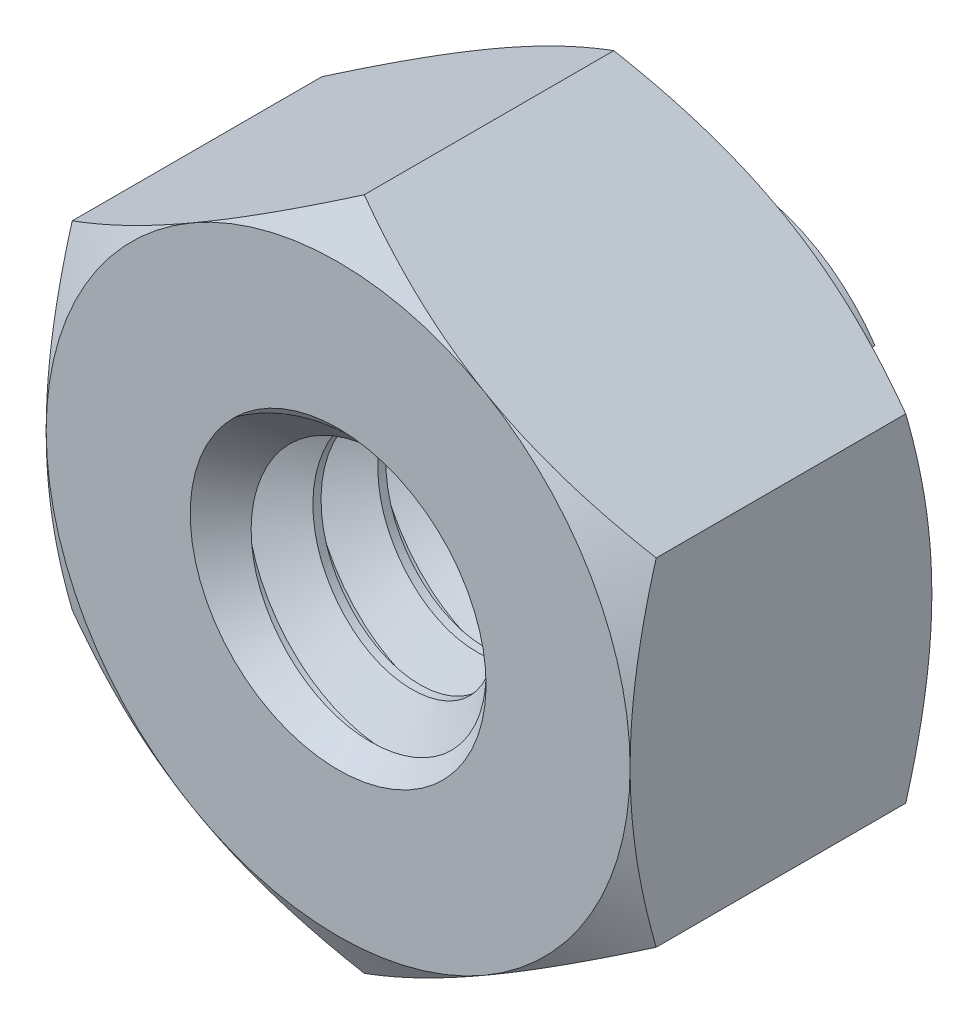
from build123d import *

# Parameters (mm, degrees)
EXTRUDE1_DEPTH          = 6.35
SKETCH2_OUTSIDE_W       = 51.616
SKETCH2_OUTSIDE_H       = 53.088
SKETCH2_OUTSIDE_R       = 4.7625
CUT_EXTRUDE1_DEPTH      = 10.656385517
CUT_EXTRUDE1_DRAFT      = -60
SKETCH4_R               = 2.413
CUT_EXTRUDE3_DEPTH      = 10.656385517
SWEEP1_PITCH            = 1.058333333
CUT_EXTRUDE8_DEPTH      = 11.383123514
CUT_EXTRUDE9_DEPTH      = 10.656385689
SKETCH12_OUTSIDE_W      = 14.702
SKETCH12_OUTSIDE_H      = 16.174
SKETCH12_OUTSIDE_R      = 2.8956
CUT_EXTRUDE10_DEPTH     = 1.42875
SKETCH15_W              = 0.381
SKETCH15_H              = 5.499261314
CUT_EXTRUDE_THIN2_DEPTH = 0.92075
CIRPATTERN1_COUNT       = 6
SKETCH3_OUTSIDE_W       = 48.59
SKETCH3_OUTSIDE_H       = 50.062
SKETCH3_OUTSIDE_R       = 4.7625
CUT_EXTRUDE2_DEPTH      = 9.783050993
CUT_EXTRUDE2_DRAFT      = -60


with BuildPart() as part:
    # Sketch1 → Extrude1 (new body)
    with BuildSketch(Plane.XY):
        Polygon((0, 5.499261314), (-4.7625, 2.749630657), (-4.7625, -2.749630657), (0, -5.499261314), (4.7625, -2.749630657), (4.7625, 2.749630657), align=None)
    extrude(amount=-EXTRUDE1_DEPTH)


with BuildPart() as cut_extrude1_tool:
    # Sketch2 outside → Cut-Extrude1 (with draft: the straight prism first)
    with BuildSketch(Plane.XY):
        Rectangle(SKETCH2_OUTSIDE_W, SKETCH2_OUTSIDE_H)
        Circle(SKETCH2_OUTSIDE_R, mode=Mode.SUBTRACT)
    extrude(amount=-CUT_EXTRUDE1_DEPTH)
    # Cut-Extrude1: the draft: its side faces are tilted about the plane it starts from
    cut_extrude1_sides = [cut_extrude1_tool.faces().sort_by_distance(p)[0] for p in [
        (0, -26.544, -5.328192758),
        (25.808, 0, -5.328192758),
        (0, 26.544, -5.328192758),
        (-25.808, 0, -5.328192758),
        (-4.7625, 0, -5.328192758),
    ]]
    draft(cut_extrude1_sides, Plane.XY, CUT_EXTRUDE1_DRAFT)


with BuildPart() as part_1:
    add(part.part)

    # Cut-Extrude1: cut by cut_extrude1_tool
    add(cut_extrude1_tool.part, mode=Mode.SUBTRACT)

    # Sketch4 → Cut-Extrude3 (cut, through all)
    with BuildSketch(Plane.XY):
        Circle(SKETCH4_R)
    extrude(amount=-CUT_EXTRUDE3_DEPTH, mode=Mode.SUBTRACT)

    # Sweep1: the profile of Sketch9 profile screwed along a right-hand helix of 7 turns, 6 arcs to a turn; built about Z, then put on its axis
    sweep1_z = Axis((0, 0, 0), (0, 0, 1))
    sweep1_corners = [(1.725592336, 0, -0.529166667), (1.725592336, 0, -0.396875), (2.4133, 0, 0.000173205), (2.4133, 0, -0.926214872)]
    with BuildLine(mode=Mode.PRIVATE) as sweep1_profile:
        Line(sweep1_corners[0], sweep1_corners[1])
        Line(sweep1_corners[1], sweep1_corners[2])
        Line(sweep1_corners[2], sweep1_corners[3])
        Line(sweep1_corners[3], sweep1_corners[0])
    sweep1_cap = Face(sweep1_profile.wire())
    sweep1_turn_angles = [0, 30, 60, 90, 120, 150, 180, 210, 240, 270, 300, 330, 360]
    sweep1_turn_weights = [1, 0.8660254037844387, 1, 0.8660254037844387, 1, 0.8660254037844387, 1, 0.8660254037844387, 1, 0.8660254037844387, 1, 0.8660254037844387, 1]
    sweep1_turn_rails = [Edge.make_bspline([Vector(p[0], p[1], 0).rotate(sweep1_z, sweep1_turn_angles[k]) / sweep1_turn_weights[k] + Vector(0, 0, p[2] + SWEEP1_PITCH * sweep1_turn_angles[k] / 360) for k in range(13)], [0, 0, 0, 1, 1, 2, 2, 3, 3, 4, 4, 5, 5, 6, 6, 6], 2, sweep1_turn_weights) for p in sweep1_corners]
    sweep1_turn_sides = [Face.make_surface_from_curves(sweep1_turn_rails[p[0]], sweep1_turn_rails[p[1]]) for p in [(0, 1), (1, 2), (2, 3), (3, 0)]]
    sweep1 = Plane(origin=(0, 0, 0), x_dir=(0, 1, 0), z_dir=(0, 0, -1)) * Solid(Shell([*[p.moved(Location((0, 0, SWEEP1_PITCH * i))) for i in range(7) for p in sweep1_turn_sides], sweep1_cap, sweep1_cap.rotate(sweep1_z, 2520).moved(Location((0, 0, SWEEP1_PITCH * 2520 / 360)))]))
    add(sweep1)

    # Sketch10 → Cut-Extrude8 (cut, through all)
    with BuildSketch(Plane.XY):
        Polygon((0, 5.499261314), (-4.7625, 2.749630657), (-4.7625, -2.749630657), (0, -5.499261314), (4.7625, -2.749630657), (4.7625, 2.749630657), align=None)
    extrude(amount=CUT_EXTRUDE8_DEPTH, mode=Mode.SUBTRACT)

    # Sketch11 → Cut-Extrude9 (cut, through all)
    with BuildSketch(Plane(origin=(0, 0, -6.35), x_dir=(-1, 0, 0), z_dir=(0, 0, -1))):
        Polygon((4.7625, 2.749630657), (0, 5.499261314), (-4.7625, 2.749630657), (-4.7625, -2.749630657), (0, -5.499261314), (4.7625, -2.749630657), align=None)
    extrude(amount=CUT_EXTRUDE9_DEPTH, mode=Mode.SUBTRACT)

    # Sketch12 outside → Cut-Extrude10 (cut)
    with BuildSketch(Plane(origin=(0, 0, -6.35), x_dir=(-1, 0, 0), z_dir=(0, 0, -1))):
        Rectangle(SKETCH12_OUTSIDE_W, SKETCH12_OUTSIDE_H)
        Circle(SKETCH12_OUTSIDE_R, mode=Mode.SUBTRACT)
    extrude(amount=-CUT_EXTRUDE10_DEPTH, mode=Mode.SUBTRACT)

    # Sketch15 → Cut-Extrude-Thin2 (cut)
    with BuildSketch(Plane(origin=(0, 0, -6.35), x_dir=(-1, 0, 0), z_dir=(0, 0, -1))):
        with Locations((0, -2.749630657)):
            Rectangle(SKETCH15_W, SKETCH15_H)
    cut_extrude_thin2 = extrude(amount=-CUT_EXTRUDE_THIN2_DEPTH, mode=Mode.SUBTRACT)

    # CirPattern1: Cut-Extrude-Thin2 ×6 about axis
    cirpattern1_axis = Axis((0, 0, 0), (0, 0, 1))
    for i in range(1, CIRPATTERN1_COUNT):
        add(cut_extrude_thin2.rotate(cirpattern1_axis, i * 360 / CIRPATTERN1_COUNT), mode=Mode.SUBTRACT)


with BuildPart() as cut_extrude2_tool:
    # Sketch3 outside → Cut-Extrude2 (with draft: the straight prism first)
    with BuildSketch(Plane(origin=(0, 0, -4.92125), x_dir=(-1, 0, 0), z_dir=(0, 0, -1))):
        Rectangle(SKETCH3_OUTSIDE_W, SKETCH3_OUTSIDE_H)
        Circle(SKETCH3_OUTSIDE_R, mode=Mode.SUBTRACT)
    extrude(amount=-CUT_EXTRUDE2_DEPTH)
    # Cut-Extrude2: the draft: its side faces are tilted about the plane it starts from
    cut_extrude2_sides = [cut_extrude2_tool.faces().sort_by_distance(p)[0] for p in [
        (0, -25.031, -0.029724503),
        (-24.295, 0, -0.029724503),
        (0, 25.031, -0.029724503),
        (24.295, 0, -0.029724503),
        (4.7625, 0, -0.029724503),
    ]]
    draft(cut_extrude2_sides, Plane(origin=(0, 0, -4.92125), x_dir=(-1, 0, 0), z_dir=(0, 0, -1)), CUT_EXTRUDE2_DRAFT)


with BuildPart() as part_2:
    add(part_1.part)

    # Cut-Extrude2: cut by cut_extrude2_tool
    add(cut_extrude2_tool.part, mode=Mode.SUBTRACT)

    # Cut-Extrude6 cone 1 section (through the dimple's axis) → Cut-Extrude6 (revolve, cut)
    with BuildSketch(Plane(origin=(0, 0, 0), x_dir=(0, -1, 0), z_dir=(1, 0, 0))):
        Polygon((0, 0), (2.413, 0), (0, 2.413), align=None)
    revolve(axis=Axis((0, 0, 0), (0, 0, -1)), mode=Mode.SUBTRACT)

    # Cut-Extrude7 cone 1 section (through the dimple's axis) → Cut-Extrude7 (revolve, cut)
    with BuildSketch(Plane(origin=(0, 0, -6.35), x_dir=(0, 1, 0), z_dir=(1, 0, 0))):
        Polygon((0, 0), (2.413, 0), (0, 2.413), align=None)
    revolve(axis=Axis((0, 0, -6.35), (0, 0, 1)), mode=Mode.SUBTRACT)


solid = part_2.part
